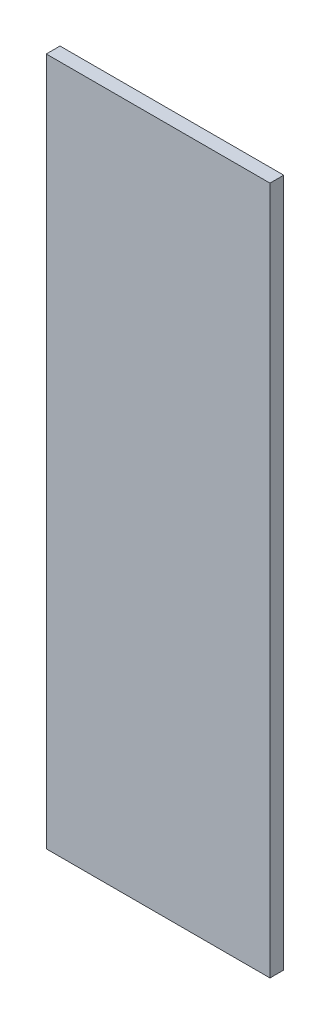
from build123d import *

# Parameters (mm, degrees)
SKETCH1_W           = 26
SKETCH1_H           = 80
BOSS_EXTRUDE1_DEPTH = 1.6


with BuildPart() as part:
    # Sketch1 → Boss-Extrude1 (new body)
    with BuildSketch(Plane.XY):
        with Locations((0, 40)):
            Rectangle(SKETCH1_W, SKETCH1_H)
    extrude(amount=BOSS_EXTRUDE1_DEPTH)


solid = part.part
